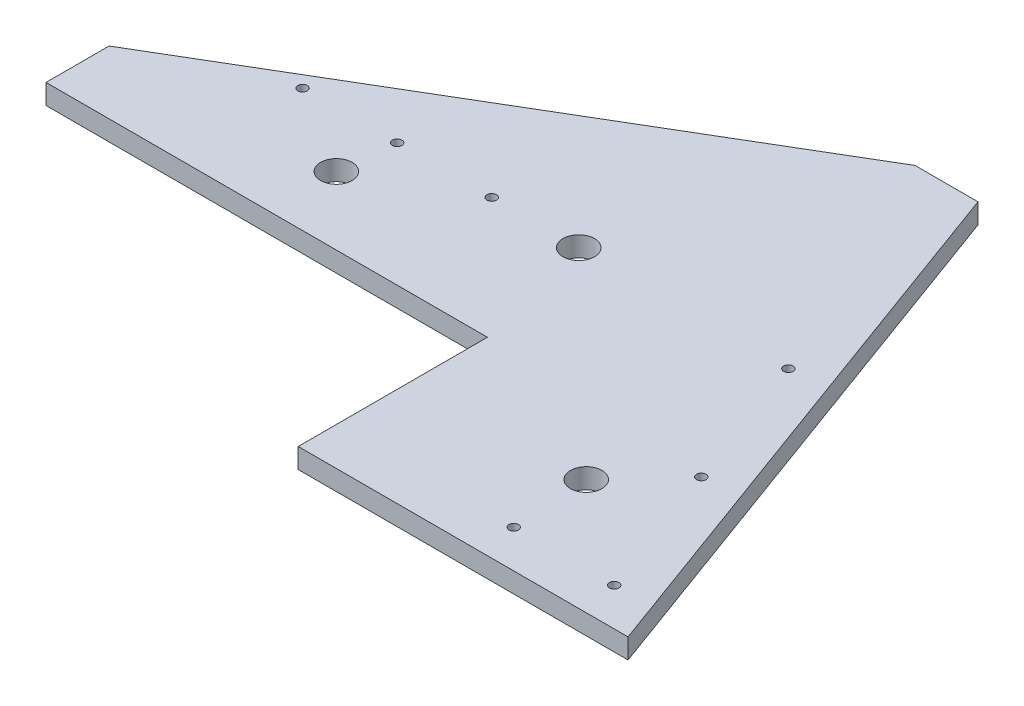
from build123d import *

# Parameters (mm, degrees)
SKETCH1_R           = 5
BOSS_EXTRUDE2_DEPTH = 6.35
SKETCH3_R           = 1.5
CUT_EXTRUDE1_DEPTH  = 6.35


with BuildPart() as part:
    # Sketch1 → Boss-Extrude2 (new body)
    with BuildSketch(Plane(origin=(0, 0, 0), x_dir=(1, 0, 0), z_dir=(0, 1, 0))):
        Polygon((180.6, 175), (160.6, 175), (0, 80), (0, 60), (70.5, 60), (140, 60), (140, 0), (194.75, 0), (244.6, 0), align=None)
        with Locations((194.75, 36.59)):
            Circle(SKETCH1_R, mode=Mode.SUBTRACT)
        with BuildLine():
            ThreePointArc((75.5, 81.59), (74.035533906, 78.054466094), (70.5, 76.59))
            ThreePointArc((70.5, 76.59), (66.964466094, 85.125533906), (75.5, 81.59))
        make_face(mode=Mode.SUBTRACT)
        with Locations((129.875, 99.09)):
            Circle(SKETCH1_R, mode=Mode.SUBTRACT)
    extrude(amount=BOSS_EXTRUDE2_DEPTH)

    # Sketch3 → Cut-Extrude1 (cut)
    with BuildSketch(Plane(origin=(0, 6.35, 0), x_dir=(1, 0, 0), z_dir=(0, 1, 0))):
        with Locations((42.27958751, 99.09440108)):
            Circle(SKETCH3_R)
        with Locations((196.359761891, 12)):
            Circle(SKETCH3_R)
        with Locations((228.211428571, 12)):
            Circle(SKETCH3_R)
        with Locations((212.285595231, 55.54720054)):
            Circle(SKETCH3_R)
        with Locations((196.359761891, 99.09440108)):
            Circle(SKETCH3_R)
        with Locations((102.27958751, 99.09440108)):
            Circle(SKETCH3_R)
        with Locations((72.27958751, 99.09440108)):
            Circle(SKETCH3_R)
    extrude(amount=-CUT_EXTRUDE1_DEPTH, mode=Mode.SUBTRACT)


solid = part.part
